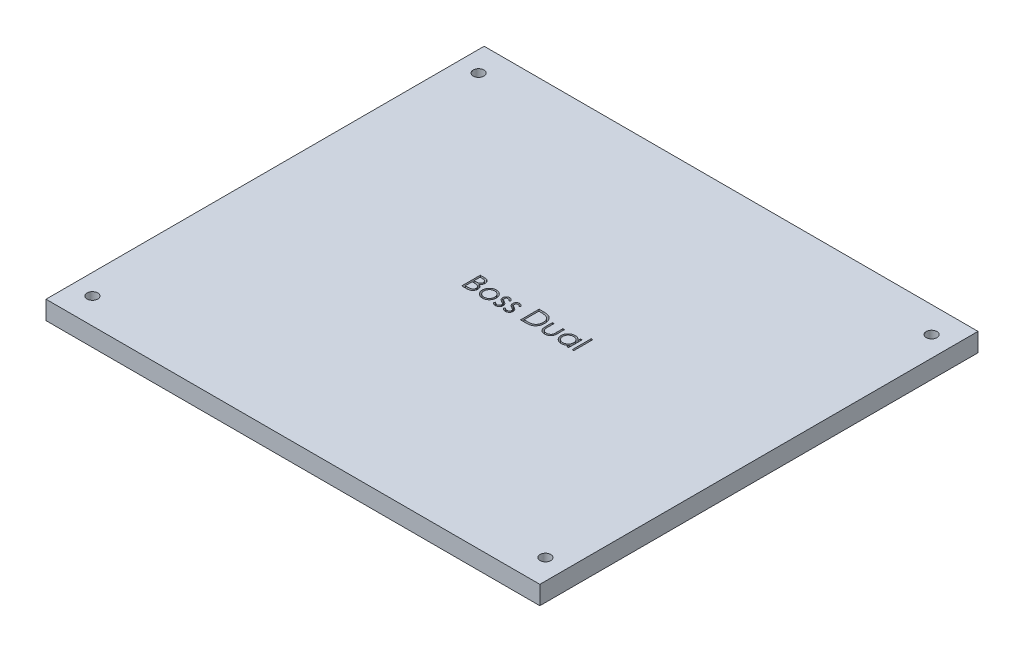
from build123d import *

# Parameters (mm, degrees)
SKETCH2_W           = 168.91
SKETCH2_H           = 149.86
BOSS_EXTRUDE1_DEPTH = 6.35
SKETCH3_R           = 1.8288
CUT_EXTRUDE1_DEPTH  = 114.081715697
SKETCH5_W           = 0.569871795
SKETCH5_H           = 6.512820513
CUT_EXTRUDE2_DEPTH  = 2.54


with BuildPart() as part:
    # Sketch2 → Boss-Extrude1 (new body)
    with BuildSketch(Plane(origin=(0, 0, 0), x_dir=(1, 0, 0), z_dir=(0, 1, 0))):
        Rectangle(SKETCH2_W, SKETCH2_H)
    extrude(amount=BOSS_EXTRUDE1_DEPTH)

    # Sketch3 → Cut-Extrude1 (cut, through all)
    with BuildSketch(Plane(origin=(0, 6.35, 0), x_dir=(1, 0, 0), z_dir=(0, 1, 0))):
        with Locations((-77.47, 66.04)):
            Circle(SKETCH3_R)
        with Locations((77.47, 66.04)):
            Circle(SKETCH3_R)
        with Locations((77.47, -66.04)):
            Circle(SKETCH3_R)
        with Locations((-77.47, -66.04)):
            Circle(SKETCH3_R)
    extrude(amount=-CUT_EXTRUDE1_DEPTH, mode=Mode.SUBTRACT)

    # Sketch5 → Cut-Extrude2 (cut)
    # profile 1 of 8: a face of its own
    with BuildSketch(Plane(origin=(0, 6.35, 0), x_dir=(1, 0, 0), z_dir=(0, 1, 0))):
        with BuildLine():
            Line((-17.296209186, 6.449507207), (-16.057246847, 6.449507207))
            add(Edge.make_bspline(
                [(-16.057246847, 6.449507207), (-15.996598036, 6.449188346), (-15.879045548, 6.448570313), (-15.70810456, 6.438985204), (-15.547996004, 6.425915688), (-15.398673445, 6.405178235), (-15.260205885, 6.38015601), (-15.132176029, 6.349854144), (-15.014991002, 6.313520145), (-14.875086466, 6.255741892), (-14.715573267, 6.169884144), (-14.542856183, 6.043013747), (-14.395165635, 5.887833421), (-14.267827602, 5.712786317), (-14.166588428, 5.520225703), (-14.093346989, 5.314741175), (-14.0469777, 5.098983157), (-14.04220897, 4.950859106), (-14.03979893, 4.875999595)],
                knots=[0, 0, 0, 0, 1.001505555, 1.941167018, 2.826882275, 3.653841531, 4.429895133, 5.150066043, 5.825578002, 6.45369114, 7.647487171, 8.808567382, 9.977351308, 11.170798116, 12.373658725, 13.556498008, 14.765093433, 16, 16, 16, 16], degree=3))
            add(Edge.make_bspline(
                [(-14.03979893, 4.875999595), (-14.041782341, 4.805872816), (-14.04567993, 4.66806708), (-14.082950364, 4.466510625), (-14.141299006, 4.274647699), (-14.222407101, 4.093178515), (-14.327820722, 3.926203245), (-14.452749386, 3.772374919), (-14.603474442, 3.638206573), (-14.716401463, 3.563198736), (-14.773763273, 3.525098153)],
                knots=[0, 0, 0, 0, 1.044552857, 2.05264487, 3.044412934, 4.028983338, 5.005914585, 5.980388656, 6.974128949, 8, 8, 8, 8], degree=3))
            add(Edge.make_bspline(
                [(-14.773763273, 3.525098153), (-14.701626497, 3.497403083), (-14.563610976, 3.444415555), (-14.373680639, 3.35073407), (-14.21004142, 3.248839956), (-14.071435169, 3.137566456), (-13.952893995, 3.017626185), (-13.849383659, 2.887260478), (-13.761061737, 2.744768731), (-13.685382576, 2.591636603), (-13.626329833, 2.429427725), (-13.582104977, 2.259663602), (-13.556764034, 2.082952981), (-13.553157885, 1.962692364), (-13.551337392, 1.901981166)],
                knots=[0, 0, 0, 0, 1.27268992, 2.434971085, 3.483601985, 4.442670788, 5.356604649, 6.2567628, 7.179492994, 8.113709626, 9.066344395, 10.018646069, 10.999752585, 12, 12, 12, 12], degree=3))
            add(Edge.make_bspline(
                [(-13.551337392, 1.901981166), (-13.553109669, 1.839992698), (-13.556596676, 1.71802865), (-13.582323196, 1.538858621), (-13.625882576, 1.367635503), (-13.685883084, 1.203251814), (-13.764191855, 1.04602557), (-13.85949259, 0.895778649), (-13.973124141, 0.754020649), (-14.100238204, 0.619176361), (-14.244042382, 0.497931661), (-14.399192394, 0.389953165), (-14.567642146, 0.301151024), (-14.74662505, 0.226554813), (-14.93814888, 0.169573182), (-15.141353611, 0.129708655), (-15.356063987, 0.102848088), (-15.503401678, 0.10063973), (-15.57896159, 0.099507207)],
                knots=[0, 0, 0, 0, 0.978564426, 1.925352924, 2.850884081, 3.763762016, 4.682927383, 5.618979971, 6.567305752, 7.547517671, 8.540179244, 9.531824382, 10.526200242, 11.540722885, 12.589160233, 13.674978461, 14.80764778, 16, 16, 16, 16], degree=3))
            Line((-15.57896159, 0.099507207), (-17.296209186, 0.099507207))
            Line((-17.296209186, 0.099507207), (-17.296209186, 6.449507207))
        make_face()
        with BuildLine():
            Line((-16.726337392, 5.798225156), (-16.726337392, 3.762968746))
            Line((-16.726337392, 3.762968746), (-16.343454779, 3.762968746))
            add(Edge.make_bspline(
                [(-16.343454779, 3.762968746), (-16.287486251, 3.76369432), (-16.179343647, 3.765096278), (-16.022734692, 3.769112231), (-15.877365016, 3.780357252), (-15.743485548, 3.791599042), (-15.621307114, 3.809877223), (-15.511100394, 3.83163436), (-15.411135796, 3.854644773), (-15.295856907, 3.893777985), (-15.165095986, 3.951613196), (-15.025698783, 4.041369242), (-14.902809102, 4.148274854), (-14.799037061, 4.271629885), (-14.714107679, 4.407458536), (-14.65511851, 4.553593591), (-14.615118438, 4.706392973), (-14.611505231, 4.811291803), (-14.609670725, 4.864551278)],
                knots=[0, 0, 0, 0, 1.156816544, 2.235205308, 3.236616184, 4.169592532, 5.011045266, 5.787822928, 6.49130361, 7.128639758, 8.301311294, 9.436451833, 10.541879658, 11.654887649, 12.756523258, 13.837046038, 14.901820046, 16, 16, 16, 16], degree=3))
            add(Edge.make_bspline(
                [(-14.609670725, 4.864551278), (-14.610625366, 4.899795178), (-14.612497999, 4.968929936), (-14.627834705, 5.069712335), (-14.65390159, 5.164497429), (-14.687382951, 5.254584172), (-14.734171, 5.337155672), (-14.789258998, 5.415066898), (-14.855817322, 5.485664599), (-14.931577018, 5.55164926), (-15.018678376, 5.610150046), (-15.117069434, 5.66138686), (-15.228081363, 5.702645126), (-15.349843257, 5.738778717), (-15.484229373, 5.764157478), (-15.62968892, 5.785300053), (-15.787413338, 5.796063742), (-15.896533739, 5.797488615), (-15.952939956, 5.798225156)],
                knots=[0, 0, 0, 0, 0.91205012, 1.789085906, 2.630437955, 3.453916878, 4.269457761, 5.079663411, 5.91843418, 6.774407191, 7.675494373, 8.627863946, 9.638891023, 10.736472738, 11.911756761, 13.175263542, 14.539845004, 16, 16, 16, 16], degree=3))
            Line((-15.952939956, 5.798225156), (-16.726337392, 5.798225156))
        make_face(mode=Mode.SUBTRACT)
        with BuildLine():
            Line((-16.726337392, 3.111686695), (-16.726337392, 0.750789259))
            Line((-16.726337392, 0.750789259), (-15.914778898, 0.750789259))
            add(Edge.make_bspline(
                [(-15.914778898, 0.750789259), (-15.856687418, 0.751485486), (-15.744723749, 0.752827373), (-15.58306866, 0.757208065), (-15.433239315, 0.767172622), (-15.295919411, 0.782858663), (-15.169626161, 0.79987385), (-15.055874615, 0.822754317), (-14.953742678, 0.848968859), (-14.835316434, 0.889489429), (-14.701960069, 0.95243874), (-14.558248944, 1.047351694), (-14.430475662, 1.160423981), (-14.321971835, 1.291290068), (-14.23304827, 1.433586904), (-14.168359087, 1.584436325), (-14.12846139, 1.741345782), (-14.123631454, 1.848328246), (-14.121209186, 1.901981166)],
                knots=[0, 0, 0, 0, 1.160039823, 2.235823828, 3.228722157, 4.157150951, 4.99529583, 5.772374946, 6.472645482, 7.099169577, 8.269452708, 9.405989375, 10.527446681, 11.663510218, 12.788923519, 13.866172445, 14.929861265, 16, 16, 16, 16], degree=3))
            add(Edge.make_bspline(
                [(-14.121209186, 1.901981166), (-14.121710119, 1.935533369), (-14.122703903, 2.002096576), (-14.137691019, 2.099915277), (-14.159487611, 2.194667933), (-14.187666069, 2.286611833), (-14.228704245, 2.374084673), (-14.276613263, 2.45881646), (-14.332786092, 2.540919201), (-14.420314793, 2.644718575), (-14.547626822, 2.76431087), (-14.7285234, 2.881400338), (-14.93421314, 2.975829931), (-15.083397306, 3.015924695), (-15.160461991, 3.036636614)],
                knots=[0, 0, 0, 0, 0.723448775, 1.435228256, 2.130040452, 2.821711965, 3.505591119, 4.210454504, 4.921174351, 5.648778258, 7.137944449, 8.670945889, 10.280296675, 12, 12, 12, 12], degree=3))
            add(Edge.make_bspline(
                [(-15.160461991, 3.036636614), (-15.191357636, 3.042905124), (-15.258345768, 3.056496545), (-15.367579521, 3.070843379), (-15.492286026, 3.08362513), (-15.632753246, 3.093079659), (-15.789158901, 3.102852388), (-15.961837025, 3.106652992), (-16.150082439, 3.111187364), (-16.280697171, 3.111515993), (-16.34854292, 3.111686695)],
                knots=[0, 0, 0, 0, 0.634451884, 1.375622551, 2.216452059, 3.157844607, 4.20941857, 5.370758133, 6.634282058, 8, 8, 8, 8], degree=3))
            Line((-16.34854292, 3.111686695), (-16.726337392, 3.111686695))
        make_face(mode=Mode.SUBTRACT)
    # profile 2 of 8: a face of its own
    with BuildSketch(Plane(origin=(0, 6.35, 0), x_dir=(1, 0, 0), z_dir=(0, 1, 0))):
        with BuildLine():
            add(Edge.make_bspline(
                [(-10.17026768, 4.821302079), (-10.083197799, 4.819448077), (-9.912475042, 4.815812831), (-9.662452163, 4.776959965), (-9.423791702, 4.717546889), (-9.195579611, 4.635411341), (-8.980738618, 4.525316945), (-8.776139361, 4.393945802), (-8.582342787, 4.238311668), (-8.46618672, 4.117919173), (-8.407226815, 4.05680889)],
                knots=[0, 0, 0, 0, 1.054011418, 2.066658804, 3.057071809, 4.030435133, 4.997543892, 5.974964718, 6.972108034, 8, 8, 8, 8], degree=3))
            add(Edge.make_bspline(
                [(-8.407226815, 4.05680889), (-8.356459555, 3.998363516), (-8.255907522, 3.882603846), (-8.126974004, 3.694905806), (-8.015900602, 3.500523052), (-7.926886373, 3.296874331), (-7.856700687, 3.085737427), (-7.806870067, 2.866386636), (-7.777230199, 2.639306377), (-7.773233388, 2.485085128), (-7.771209186, 2.406979163)],
                knots=[0, 0, 0, 0, 1.025258237, 2.030674902, 3.01204498, 3.988269485, 4.97094183, 5.956517959, 6.965070386, 8, 8, 8, 8], degree=3))
            add(Edge.make_bspline(
                [(-7.771209186, 2.406979163), (-7.772989613, 2.328420486), (-7.776507818, 2.173184879), (-7.809788379, 1.944549744), (-7.861551921, 1.722853423), (-7.935632542, 1.509024078), (-8.030625111, 1.302408091), (-8.146541073, 1.103907909), (-8.284193864, 0.913131896), (-8.440229687, 0.731699989), (-8.612680948, 0.564484143), (-8.799763102, 0.418745711), (-8.997799707, 0.293883802), (-9.209424076, 0.193306305), (-9.432703659, 0.11400442), (-9.668120054, 0.058305819), (-9.915307539, 0.024629621), (-10.084085498, 0.020305138), (-10.17026768, 0.018096951)],
                knots=[0, 0, 0, 0, 0.998656419, 1.973391657, 2.932242238, 3.890759089, 4.846373663, 5.82037756, 6.809684879, 7.83454468, 8.860553229, 9.859544525, 10.845671541, 11.83227036, 12.833544569, 13.85385346, 14.904124723, 16, 16, 16, 16], degree=3))
            add(Edge.make_bspline(
                [(-10.17026768, 0.018096951), (-10.2568721, 0.02031255), (-10.426491231, 0.024651912), (-10.674551227, 0.058174982), (-10.910389535, 0.113978751), (-11.133961421, 0.193566916), (-11.346495644, 0.293887017), (-11.545679717, 0.418368225), (-11.732913849, 0.564527364), (-11.905401592, 0.731688278), (-12.061427633, 0.913134913), (-12.199082948, 1.103907126), (-12.314998254, 1.302408295), (-12.409990996, 1.509024024), (-12.484071571, 1.722853437), (-12.535835125, 1.94454974), (-12.569115682, 2.17318488), (-12.572633888, 2.328420487), (-12.574414315, 2.406979163)],
                knots=[0, 0, 0, 0, 1.099876186, 2.154163076, 3.173186993, 4.173200201, 5.163417411, 6.152872554, 7.150605724, 8.17532212, 9.198891216, 10.186952605, 11.159729845, 12.11414092, 13.071450619, 14.029093627, 15.002601286, 16, 16, 16, 16], degree=3))
            add(Edge.make_bspline(
                [(-12.574414315, 2.406979163), (-12.572376309, 2.48466061), (-12.568341407, 2.638456526), (-12.538731341, 2.865109907), (-12.489095103, 3.084089456), (-12.418825283, 3.294411391), (-12.32899058, 3.497167682), (-12.219477957, 3.692030733), (-12.089229238, 3.878880028), (-11.989077126, 3.994490087), (-11.938396686, 4.052992784)],
                knots=[0, 0, 0, 0, 1.031353054, 2.041901799, 3.029428768, 4.008703097, 4.981709435, 5.96992636, 6.972712378, 8, 8, 8, 8], degree=3))
            add(Edge.make_bspline(
                [(-11.938396686, 4.052992784), (-11.879525671, 4.114633031), (-11.763745461, 4.235859423), (-11.568984198, 4.39103986), (-11.364888265, 4.525144736), (-11.147673042, 4.633051584), (-10.919648429, 4.718030038), (-10.679764946, 4.777113187), (-10.428893653, 4.815672845), (-10.257335484, 4.819406968), (-10.17026768, 4.821302079)],
                knots=[0, 0, 0, 0, 1.027980169, 2.021703884, 2.998553061, 3.971491411, 4.943284454, 5.930300938, 6.949603206, 8, 8, 8, 8], degree=3))
        make_face()
        with BuildLine():
            add(Edge.make_bspline(
                [(-10.172811751, 4.251430284), (-10.234384274, 4.249680239), (-10.355939836, 4.246225327), (-10.53486394, 4.219947385), (-10.707112505, 4.178314057), (-10.873012322, 4.119160983), (-11.032003935, 4.042781552), (-11.184239565, 3.948967813), (-11.330166991, 3.838962306), (-11.466931592, 3.712937173), (-11.592448073, 3.575270998), (-11.702172402, 3.428588975), (-11.795472238, 3.275270318), (-11.873196526, 3.115155592), (-11.931085281, 2.946622213), (-11.973127765, 2.771578782), (-11.999380916, 2.589668669), (-12.002803345, 2.466005107), (-12.00454252, 2.403163057)],
                knots=[0, 0, 0, 0, 1.021534396, 2.016698045, 2.994645724, 3.958388632, 4.93408049, 5.916473867, 6.921342795, 7.962252576, 8.998418191, 10.008913653, 10.997312074, 11.973003931, 12.956656626, 13.948281152, 14.957379055, 16, 16, 16, 16], degree=3))
            add(Edge.make_bspline(
                [(-12.00454252, 2.403163057), (-12.001627283, 2.321970093), (-11.995841082, 2.160817243), (-11.948787153, 1.923488492), (-11.870072045, 1.695647132), (-11.763777981, 1.478628831), (-11.630598127, 1.277837698), (-11.473685877, 1.098819434), (-11.294725278, 0.944268033), (-11.095849628, 0.816032785), (-10.881121079, 0.714142942), (-10.653870325, 0.641936229), (-10.416850781, 0.594997587), (-10.254870025, 0.590332198), (-10.172811751, 0.587968746)],
                knots=[0, 0, 0, 0, 1.016792936, 2.018143844, 3.017858371, 4.030088057, 5.03801393, 6.028138512, 7.003788237, 7.991172063, 8.984598303, 9.972568034, 10.972917682, 12, 12, 12, 12], degree=3))
            add(Edge.make_bspline(
                [(-10.172811751, 0.587968746), (-10.090758196, 0.590345969), (-9.928786757, 0.59503854), (-9.692096536, 0.641699828), (-9.465466902, 0.714459326), (-9.250961384, 0.815918193), (-9.052176261, 0.944755002), (-8.871928569, 1.097946715), (-8.716356089, 1.278311845), (-8.583307977, 1.478894791), (-8.475273173, 1.695310687), (-8.396926507, 1.923530543), (-8.349759458, 2.160806534), (-8.343988526, 2.321966505), (-8.341080981, 2.403163057)],
                knots=[0, 0, 0, 0, 1.02726834, 2.027799167, 3.010890988, 4.004497153, 4.992059811, 5.971914811, 6.958719428, 7.966827853, 8.981595046, 9.981490638, 10.983022906, 12, 12, 12, 12], degree=3))
            add(Edge.make_bspline(
                [(-8.341080981, 2.403163057), (-8.342819557, 2.466005483), (-8.346240808, 2.589669784), (-8.372502529, 2.771574521), (-8.414513294, 2.946637846), (-8.472518943, 3.115097909), (-8.549905511, 3.275684882), (-8.64500455, 3.428138815), (-8.754280839, 3.57577912), (-8.881311901, 3.712492154), (-9.017933743, 3.839011435), (-9.163920313, 3.94901047), (-9.315930202, 4.04236925), (-9.474459917, 4.119814286), (-9.640381004, 4.17777589), (-9.812388224, 4.220187778), (-9.990548922, 4.246114278), (-10.1116689, 4.249646949), (-10.172811751, 4.251430284)],
                knots=[0, 0, 0, 0, 1.042956736, 2.052379634, 3.044323526, 4.02829302, 5.004299113, 5.996692471, 7.007513377, 8.048758398, 9.090003419, 10.095195979, 11.07790575, 12.047570684, 13.018257071, 13.989683339, 14.985167495, 16, 16, 16, 16], degree=3))
        make_face(mode=Mode.SUBTRACT)
    # profile 3 of 8: a face of its own
    with BuildSketch(Plane(origin=(0, 6.35, 0), x_dir=(1, 0, 0), z_dir=(0, 1, 0))):
        with BuildLine():
            Line((-4.433388674, 4.161115781), (-4.820087392, 3.762968746))
            add(Edge.make_bspline(
                [(-4.820087392, 3.762968746), (-4.853453019, 3.801636883), (-4.917778022, 3.876184499), (-5.019797995, 3.975856034), (-5.121440818, 4.059561623), (-5.221315094, 4.13023215), (-5.32193224, 4.183661316), (-5.422111505, 4.222659137), (-5.521956617, 4.246792413), (-5.588696995, 4.249902894), (-5.621469603, 4.251430284)],
                knots=[0, 0, 0, 0, 1.26578478, 2.440284043, 3.530471711, 4.527705817, 5.468200915, 6.346673037, 7.188140097, 8, 8, 8, 8], degree=3))
            add(Edge.make_bspline(
                [(-5.621469603, 4.251430284), (-5.661636782, 4.249480158), (-5.740680105, 4.245642584), (-5.853938375, 4.207336789), (-5.959077366, 4.148538078), (-6.050076459, 4.065137934), (-6.12716125, 3.969408474), (-6.183428928, 3.862372285), (-6.217838641, 3.747259406), (-6.222201512, 3.667376664), (-6.224414315, 3.626860973)],
                knots=[0, 0, 0, 0, 0.99966794, 1.967205029, 2.953328237, 3.988086729, 5.028030931, 6.008226631, 6.989793394, 8, 8, 8, 8], degree=3))
            add(Edge.make_bspline(
                [(-6.224414315, 3.626860973), (-6.222398984, 3.59019055), (-6.218374003, 3.516953078), (-6.1870836, 3.408915931), (-6.137252297, 3.303583876), (-6.090679231, 3.239062603), (-6.066681943, 3.205817304)],
                knots=[0, 0, 0, 0, 0.960159726, 1.917612774, 2.927026955, 4, 4, 4, 4], degree=3))
            add(Edge.make_bspline(
                [(-6.066681943, 3.205817304), (-6.05223389, 3.188065272), (-6.02148303, 3.15028231), (-5.963773296, 3.097842462), (-5.898418183, 3.039890092), (-5.819823439, 2.981947545), (-5.731375146, 2.920929987), (-5.631155302, 2.859240402), (-5.522344414, 2.792176374), (-5.444443872, 2.74964147), (-5.403951574, 2.727532047)],
                knots=[0, 0, 0, 0, 0.66740084, 1.420478572, 2.27185888, 3.217733974, 4.268547843, 5.408967954, 6.65319498, 8, 8, 8, 8], degree=3))
            add(Edge.make_bspline(
                [(-5.403951574, 2.727532047), (-5.35457837, 2.699873438), (-5.259205597, 2.646446112), (-5.123691577, 2.56351565), (-5.000706517, 2.481090066), (-4.889208377, 2.400050869), (-4.791342524, 2.318130666), (-4.704139692, 2.23846945), (-4.629774944, 2.158660276), (-4.588129963, 2.102901627), (-4.568224411, 2.076249996)],
                knots=[0, 0, 0, 0, 1.27191281, 2.456916733, 3.569705269, 4.599008579, 5.553216877, 6.436649441, 7.252746552, 8, 8, 8, 8], degree=3))
            add(Edge.make_bspline(
                [(-4.568224411, 2.076249996), (-4.535185311, 2.022427236), (-4.469431371, 1.915309955), (-4.400382802, 1.738927951), (-4.36035916, 1.551856039), (-4.354803418, 1.42389044), (-4.351978417, 1.358822111)],
                knots=[0, 0, 0, 0, 0.995354457, 1.980940102, 2.973342416, 4, 4, 4, 4], degree=3))
            add(Edge.make_bspline(
                [(-4.351978417, 1.358822111), (-4.353283857, 1.31297666), (-4.355856369, 1.222633191), (-4.373741719, 1.089582857), (-4.404502891, 0.962338731), (-4.446401558, 0.839520143), (-4.502978921, 0.723480353), (-4.569287067, 0.611291729), (-4.648888693, 0.505381112), (-4.73976876, 0.40588757), (-4.839274156, 0.315017714), (-4.945421007, 0.235145683), (-5.058340028, 0.168789386), (-5.177224368, 0.113879402), (-5.30234414, 0.070212706), (-5.433718908, 0.039982114), (-5.570931077, 0.021888676), (-5.664239443, 0.01937684), (-5.711784106, 0.018096951)],
                knots=[0, 0, 0, 0, 1.032770009, 2.035186124, 3.017557409, 3.978232242, 4.952395191, 5.920591857, 6.910227898, 7.931268572, 8.952309245, 9.941945286, 10.918353717, 11.897095711, 12.887975737, 13.898235213, 14.929059601, 16, 16, 16, 16], degree=3))
            add(Edge.make_bspline(
                [(-5.711784106, 0.018096951), (-5.775950268, 0.019897993), (-5.903391006, 0.023475052), (-6.09187664, 0.057050334), (-6.276064302, 0.109293406), (-6.454560154, 0.181349458), (-6.623372389, 0.27233718), (-6.777824209, 0.381307523), (-6.918452148, 0.504660804), (-6.998495302, 0.599208513), (-7.038516879, 0.646482368)],
                knots=[0, 0, 0, 0, 1.013940152, 2.01379169, 3.017749504, 4.037548394, 5.051665909, 6.043208538, 7.021604269, 8, 8, 8, 8], degree=3))
            Line((-7.038516879, 0.646482368), (-6.660722408, 1.076430284))
            add(Edge.make_bspline(
                [(-6.660722408, 1.076430284), (-6.624849601, 1.03768664), (-6.555304742, 0.962576228), (-6.44408682, 0.862564924), (-6.330912764, 0.778742618), (-6.21691269, 0.708632422), (-6.10039909, 0.654611334), (-5.982024904, 0.616659028), (-5.862030906, 0.592267422), (-5.78143646, 0.589403967), (-5.741040917, 0.587968746)],
                knots=[0, 0, 0, 0, 1.179806542, 2.287233372, 3.337373186, 4.324005949, 5.273901747, 6.200048787, 7.097828587, 8, 8, 8, 8], degree=3))
            add(Edge.make_bspline(
                [(-5.741040917, 0.587968746), (-5.686035537, 0.590455814), (-5.578564252, 0.595315127), (-5.424633433, 0.63943328), (-5.282504782, 0.708611907), (-5.159090998, 0.806737002), (-5.054039934, 0.920956398), (-4.977970246, 1.049614872), (-4.930297757, 1.188936515), (-4.924698873, 1.285515121), (-4.921850212, 1.334653441)],
                knots=[0, 0, 0, 0, 1.072336372, 2.095165389, 3.102688358, 4.141489647, 5.156069229, 6.117746104, 7.042326257, 8, 8, 8, 8], degree=3))
            add(Edge.make_bspline(
                [(-4.921850212, 1.334653441), (-4.92382106, 1.375129464), (-4.927712237, 1.455043952), (-4.958270744, 1.570705285), (-5.006554062, 1.680413837), (-5.054096781, 1.744620768), (-5.078310549, 1.777321711)],
                knots=[0, 0, 0, 0, 1.013901739, 2.00181326, 2.98231254, 4, 4, 4, 4], degree=3))
            add(Edge.make_bspline(
                [(-5.078310549, 1.777321711), (-5.092865464, 1.793714439), (-5.124571327, 1.829423722), (-5.182728693, 1.880994937), (-5.252364358, 1.936581202), (-5.33426151, 1.995239942), (-5.428585249, 2.056197412), (-5.535717868, 2.119133808), (-5.654191728, 2.187038396), (-5.737958445, 2.232068342), (-5.781746045, 2.255606967)],
                knots=[0, 0, 0, 0, 0.615000592, 1.339693406, 2.178160186, 3.116406724, 4.166410947, 5.330106347, 6.604359322, 8, 8, 8, 8], degree=3))
            add(Edge.make_bspline(
                [(-5.781746045, 2.255606967), (-5.829002092, 2.281985106), (-5.920646649, 2.333140735), (-6.050453876, 2.412817052), (-6.167561219, 2.493856251), (-6.274786547, 2.571712402), (-6.369421515, 2.6504904), (-6.451093307, 2.730277699), (-6.523017427, 2.807856531), (-6.562836302, 2.862824484), (-6.581856222, 2.889080525)],
                knots=[0, 0, 0, 0, 1.262093308, 2.447601706, 3.550203992, 4.582594899, 5.537233252, 6.418365656, 7.244515135, 8, 8, 8, 8], degree=3))
            add(Edge.make_bspline(
                [(-6.581856222, 2.889080525), (-6.61475031, 2.941958998), (-6.680549981, 3.047734423), (-6.744440399, 3.22428343), (-6.788357051, 3.410148034), (-6.792280245, 3.538394184), (-6.79428611, 3.603964339)],
                knots=[0, 0, 0, 0, 0.985009483, 1.970363186, 2.962279964, 4, 4, 4, 4], degree=3))
            add(Edge.make_bspline(
                [(-6.79428611, 3.603964339), (-6.793316927, 3.646827561), (-6.791420098, 3.730716959), (-6.776281605, 3.85397739), (-6.7487195, 3.971086184), (-6.714148426, 4.083802064), (-6.66610069, 4.189941577), (-6.608685976, 4.290920132), (-6.541217362, 4.386598154), (-6.463487392, 4.475503837), (-6.378022478, 4.556256472), (-6.285684825, 4.626648268), (-6.18855113, 4.686712655), (-6.086210141, 4.737086589), (-5.977678711, 4.775189097), (-5.863715467, 4.801418925), (-5.744551086, 4.818936221), (-5.663087615, 4.820502103), (-5.621469603, 4.821302079)],
                knots=[0, 0, 0, 0, 1.087655834, 2.128696564, 3.144119009, 4.137814668, 5.115653402, 6.093965665, 7.082169637, 8.081268856, 9.086088321, 10.061021666, 11.022561449, 11.980240094, 12.950172527, 13.934149372, 14.944599409, 16, 16, 16, 16], degree=3))
            add(Edge.make_bspline(
                [(-5.621469603, 4.821302079), (-5.572135431, 4.81929849), (-5.472541628, 4.815253725), (-5.323126807, 4.783130544), (-5.173932029, 4.730274769), (-5.024573951, 4.657274746), (-4.876146712, 4.562810557), (-4.727344701, 4.448638828), (-4.57638156, 4.315510689), (-4.482117963, 4.213730665), (-4.433388674, 4.161115781)],
                knots=[0, 0, 0, 0, 0.845714091, 1.707292901, 2.609013841, 3.555613372, 4.552488639, 5.621697636, 6.770543573, 8, 8, 8, 8], degree=3))
        make_face()
    # profile 4 of 8: a face of its own
    with BuildSketch(Plane(origin=(0, 6.35, 0), x_dir=(1, 0, 0), z_dir=(0, 1, 0))):
        with BuildLine():
            Line((-1.014157904, 4.161115781), (-1.400856622, 3.762968746))
            add(Edge.make_bspline(
                [(-1.400856622, 3.762968746), (-1.43422225, 3.801636883), (-1.498547253, 3.876184499), (-1.600567225, 3.975856034), (-1.702210049, 4.059561623), (-1.802084325, 4.13023215), (-1.90270147, 4.183661316), (-2.002880736, 4.222659137), (-2.102725847, 4.246792413), (-2.169466226, 4.249902894), (-2.202238834, 4.251430284)],
                knots=[0, 0, 0, 0, 1.26578478, 2.440284043, 3.530471711, 4.527705817, 5.468200915, 6.346673037, 7.188140097, 8, 8, 8, 8], degree=3))
            add(Edge.make_bspline(
                [(-2.202238834, 4.251430284), (-2.242406013, 4.249480158), (-2.321449336, 4.245642584), (-2.434707606, 4.207336789), (-2.539846597, 4.148538078), (-2.63084569, 4.065137934), (-2.70793048, 3.969408474), (-2.764198159, 3.862372285), (-2.798607872, 3.747259406), (-2.802970743, 3.667376664), (-2.805183545, 3.626860973)],
                knots=[0, 0, 0, 0, 0.99966794, 1.967205029, 2.953328237, 3.988086729, 5.028030931, 6.008226631, 6.989793394, 8, 8, 8, 8], degree=3))
            add(Edge.make_bspline(
                [(-2.805183545, 3.626860973), (-2.803168215, 3.59019055), (-2.799143234, 3.516953078), (-2.76785283, 3.408915931), (-2.718021528, 3.303583876), (-2.671448461, 3.239062603), (-2.647451174, 3.205817304)],
                knots=[0, 0, 0, 0, 0.960159726, 1.917612774, 2.927026955, 4, 4, 4, 4], degree=3))
            add(Edge.make_bspline(
                [(-2.647451174, 3.205817304), (-2.633003121, 3.188065272), (-2.602252261, 3.15028231), (-2.544542527, 3.097842462), (-2.479187414, 3.039890092), (-2.40059267, 2.981947545), (-2.312144377, 2.920929987), (-2.211924532, 2.859240402), (-2.103113645, 2.792176374), (-2.025213103, 2.74964147), (-1.984720805, 2.727532047)],
                knots=[0, 0, 0, 0, 0.66740084, 1.420478572, 2.27185888, 3.217733974, 4.268547843, 5.408967954, 6.65319498, 8, 8, 8, 8], degree=3))
            add(Edge.make_bspline(
                [(-1.984720805, 2.727532047), (-1.935347601, 2.699873438), (-1.839974828, 2.646446112), (-1.704460808, 2.56351565), (-1.581475747, 2.481090066), (-1.469977608, 2.400050869), (-1.372111754, 2.318130666), (-1.284908923, 2.23846945), (-1.210544175, 2.158660276), (-1.168899194, 2.102901627), (-1.148993642, 2.076249996)],
                knots=[0, 0, 0, 0, 1.27191281, 2.456916733, 3.569705269, 4.599008579, 5.553216877, 6.436649441, 7.252746552, 8, 8, 8, 8], degree=3))
            add(Edge.make_bspline(
                [(-1.148993642, 2.076249996), (-1.115954542, 2.022427236), (-1.050200602, 1.915309955), (-0.981152032, 1.738927951), (-0.941128391, 1.551856039), (-0.935572648, 1.42389044), (-0.932747648, 1.358822111)],
                knots=[0, 0, 0, 0, 0.995354457, 1.980940102, 2.973342416, 4, 4, 4, 4], degree=3))
            add(Edge.make_bspline(
                [(-0.932747648, 1.358822111), (-0.934053088, 1.31297666), (-0.9366256, 1.222633191), (-0.95451095, 1.089582857), (-0.985272121, 0.962338731), (-1.027170789, 0.839520143), (-1.083748151, 0.723480353), (-1.150056298, 0.611291729), (-1.229657923, 0.505381112), (-1.32053799, 0.40588757), (-1.420043387, 0.315017714), (-1.526190238, 0.235145683), (-1.639109259, 0.168789386), (-1.757993599, 0.113879402), (-1.883113371, 0.070212706), (-2.014488139, 0.039982114), (-2.151700308, 0.021888676), (-2.245008674, 0.01937684), (-2.292553337, 0.018096951)],
                knots=[0, 0, 0, 0, 1.032770009, 2.035186124, 3.017557409, 3.978232242, 4.952395191, 5.920591857, 6.910227898, 7.931268572, 8.952309245, 9.941945286, 10.918353717, 11.897095711, 12.887975737, 13.898235213, 14.929059601, 16, 16, 16, 16], degree=3))
            add(Edge.make_bspline(
                [(-2.292553337, 0.018096951), (-2.356719498, 0.019897993), (-2.484160237, 0.023475052), (-2.67264587, 0.057050334), (-2.856833533, 0.109293406), (-3.035329384, 0.181349458), (-3.20414162, 0.27233718), (-3.35859344, 0.381307523), (-3.499221379, 0.504660804), (-3.579264533, 0.599208513), (-3.61928611, 0.646482368)],
                knots=[0, 0, 0, 0, 1.013940152, 2.01379169, 3.017749504, 4.037548394, 5.051665909, 6.043208538, 7.021604269, 8, 8, 8, 8], degree=3))
            Line((-3.61928611, 0.646482368), (-3.241491638, 1.076430284))
            add(Edge.make_bspline(
                [(-3.241491638, 1.076430284), (-3.205618832, 1.03768664), (-3.136073973, 0.962576228), (-3.024856051, 0.862564924), (-2.911681995, 0.778742618), (-2.79768192, 0.708632422), (-2.681168321, 0.654611334), (-2.562794135, 0.616659028), (-2.442800137, 0.592267422), (-2.36220569, 0.589403967), (-2.321810148, 0.587968746)],
                knots=[0, 0, 0, 0, 1.179806542, 2.287233372, 3.337373186, 4.324005949, 5.273901747, 6.200048787, 7.097828587, 8, 8, 8, 8], degree=3))
            add(Edge.make_bspline(
                [(-2.321810148, 0.587968746), (-2.266804768, 0.590455814), (-2.159333483, 0.595315127), (-2.005402663, 0.63943328), (-1.863274013, 0.708611907), (-1.739860229, 0.806737002), (-1.634809165, 0.920956398), (-1.558739477, 1.049614872), (-1.511066987, 1.188936515), (-1.505468104, 1.285515121), (-1.502619443, 1.334653441)],
                knots=[0, 0, 0, 0, 1.072336372, 2.095165389, 3.102688358, 4.141489647, 5.156069229, 6.117746104, 7.042326257, 8, 8, 8, 8], degree=3))
            add(Edge.make_bspline(
                [(-1.502619443, 1.334653441), (-1.504590291, 1.375129464), (-1.508481467, 1.455043952), (-1.539039975, 1.570705285), (-1.587323293, 1.680413837), (-1.634866012, 1.744620768), (-1.659079779, 1.777321711)],
                knots=[0, 0, 0, 0, 1.013901739, 2.00181326, 2.98231254, 4, 4, 4, 4], degree=3))
            add(Edge.make_bspline(
                [(-1.659079779, 1.777321711), (-1.673634695, 1.793714439), (-1.705340558, 1.829423722), (-1.763497924, 1.880994937), (-1.833133589, 1.936581202), (-1.915030741, 1.995239942), (-2.009354479, 2.056197412), (-2.116487099, 2.119133808), (-2.234960959, 2.187038396), (-2.318727675, 2.232068342), (-2.362515276, 2.255606967)],
                knots=[0, 0, 0, 0, 0.615000592, 1.339693406, 2.178160186, 3.116406724, 4.166410947, 5.330106347, 6.604359322, 8, 8, 8, 8], degree=3))
            add(Edge.make_bspline(
                [(-2.362515276, 2.255606967), (-2.409771323, 2.281985106), (-2.501415879, 2.333140735), (-2.631223107, 2.412817052), (-2.74833045, 2.493856251), (-2.855555778, 2.571712402), (-2.950190745, 2.6504904), (-3.031862537, 2.730277699), (-3.103786657, 2.807856531), (-3.143605533, 2.862824484), (-3.162625453, 2.889080525)],
                knots=[0, 0, 0, 0, 1.262093308, 2.447601706, 3.550203992, 4.582594899, 5.537233252, 6.418365656, 7.244515135, 8, 8, 8, 8], degree=3))
            add(Edge.make_bspline(
                [(-3.162625453, 2.889080525), (-3.19551954, 2.941958998), (-3.261319211, 3.047734423), (-3.32520963, 3.22428343), (-3.369126282, 3.410148034), (-3.373049476, 3.538394184), (-3.37505534, 3.603964339)],
                knots=[0, 0, 0, 0, 0.985009483, 1.970363186, 2.962279964, 4, 4, 4, 4], degree=3))
            add(Edge.make_bspline(
                [(-3.37505534, 3.603964339), (-3.374086157, 3.646827561), (-3.372189329, 3.730716959), (-3.357050835, 3.85397739), (-3.329488731, 3.971086184), (-3.294917657, 4.083802064), (-3.24686992, 4.189941577), (-3.189455207, 4.290920132), (-3.121986593, 4.386598154), (-3.044256622, 4.475503837), (-2.958791709, 4.556256472), (-2.866454055, 4.626648268), (-2.769320361, 4.686712655), (-2.666979371, 4.737086589), (-2.558447942, 4.775189097), (-2.444484698, 4.801418925), (-2.325320317, 4.818936221), (-2.243856846, 4.820502103), (-2.202238834, 4.821302079)],
                knots=[0, 0, 0, 0, 1.087655834, 2.128696564, 3.144119009, 4.137814668, 5.115653402, 6.093965665, 7.082169637, 8.081268856, 9.086088321, 10.061021666, 11.022561449, 11.980240094, 12.950172527, 13.934149372, 14.944599409, 16, 16, 16, 16], degree=3))
            add(Edge.make_bspline(
                [(-2.202238834, 4.821302079), (-2.152904662, 4.81929849), (-2.053310859, 4.815253725), (-1.903896038, 4.783130544), (-1.75470126, 4.730274769), (-1.605343182, 4.657274746), (-1.456915943, 4.562810557), (-1.308113931, 4.448638828), (-1.157150791, 4.315510689), (-1.062887194, 4.213730665), (-1.014157904, 4.161115781)],
                knots=[0, 0, 0, 0, 0.845714091, 1.707292901, 2.609013841, 3.555613372, 4.552488639, 5.621697636, 6.770543573, 8, 8, 8, 8], degree=3))
        make_face()
    # profile 5 of 8: a face of its own
    with BuildSketch(Plane(origin=(0, 6.35, 0), x_dir=(1, 0, 0), z_dir=(0, 1, 0))):
        with BuildLine():
            Line((2.812124147, 0.099507207), (2.812124147, 6.449507207))
            Line((2.812124147, 6.449507207), (4.094335685, 6.449507207))
            add(Edge.make_bspline(
                [(4.094335685, 6.449507207), (4.205857992, 6.448704259), (4.42131851, 6.447152967), (4.732672521, 6.437317014), (5.020751633, 6.419917169), (5.284608392, 6.394572457), (5.524967162, 6.363451954), (5.741154923, 6.324444077), (5.934289525, 6.278382682), (6.053069796, 6.239111651), (6.109239531, 6.220540861)],
                knots=[0, 0, 0, 0, 1.314313732, 2.53924729, 3.670748893, 4.714932338, 5.66265055, 6.526160246, 7.303039223, 8, 8, 8, 8], degree=3))
            add(Edge.make_bspline(
                [(6.109239531, 6.220540861), (6.182708558, 6.192545152), (6.327980579, 6.137188585), (6.534822073, 6.032765009), (6.729540945, 5.91444981), (6.913181394, 5.782087031), (7.081548608, 5.631928856), (7.241220077, 5.470353858), (7.385663933, 5.29148644), (7.517940413, 5.099036105), (7.637203681, 4.895269953), (7.740870439, 4.680576256), (7.826965541, 4.456045321), (7.898436109, 4.222301553), (7.954763254, 3.978830982), (7.99319333, 3.72535011), (8.018540697, 3.462860724), (8.021088048, 3.284744197), (8.022380557, 3.194368986)],
                knots=[0, 0, 0, 0, 0.984719456, 1.947108742, 2.898477687, 3.838006223, 4.779231079, 5.722358779, 6.681677486, 7.655904652, 8.64651281, 9.637519902, 10.640069247, 11.656948941, 12.698408672, 13.768548281, 14.867775369, 16, 16, 16, 16], degree=3))
            add(Edge.make_bspline(
                [(8.022380557, 3.194368986), (8.02123943, 3.115880739), (8.018990721, 2.961211451), (7.998798962, 2.733262969), (7.969450496, 2.512076918), (7.924013165, 2.298706576), (7.86885432, 2.091282524), (7.798162217, 1.892015452), (7.717180674, 1.699077398), (7.622747322, 1.51507712), (7.519076524, 1.34075443), (7.407821361, 1.176424544), (7.2891005, 1.024432356), (7.161781851, 0.884317588), (7.027510709, 0.756291467), (6.885407995, 0.639284525), (6.735107031, 0.535586204), (6.577281006, 0.441121594), (6.407325743, 0.358716091), (6.2220221, 0.288993074), (6.02057982, 0.231214214), (5.803493355, 0.183007018), (5.570387617, 0.144766769), (5.321034064, 0.119137457), (5.05581581, 0.101805707), (4.873699143, 0.100288251), (4.779962689, 0.099507207)],
                knots=[0, 0, 0, 0, 1.105936401, 2.179363191, 3.223086493, 4.248585256, 5.251745608, 6.245858792, 7.225916811, 8.198733463, 9.158002045, 10.082870192, 10.993790845, 11.873723703, 12.748670949, 13.606408763, 14.465103618, 15.319838547, 16.196477973, 17.123216899, 18.106603292, 19.147568657, 20.255746949, 21.433717677, 22.679120308, 24, 24, 24, 24], degree=3))
            Line((4.779962689, 0.099507207), (2.812124147, 0.099507207))
        make_face()
        with BuildLine():
            Line((3.381995942, 0.750789259), (4.110872144, 0.750789259))
            add(Edge.make_bspline(
                [(4.110872144, 0.750789259), (4.215607902, 0.751239376), (4.417053122, 0.752105118), (4.706718346, 0.7597019), (4.971385251, 0.77211513), (5.211091418, 0.789487057), (5.425701505, 0.812471544), (5.615664022, 0.838098154), (5.780356277, 0.870024957), (5.880013969, 0.898964555), (5.926066455, 0.912337736)],
                knots=[0, 0, 0, 0, 1.375205317, 2.645023457, 3.804390687, 4.853969522, 5.800190428, 6.637939096, 7.370582563, 8, 8, 8, 8], degree=3))
            add(Edge.make_bspline(
                [(5.926066455, 0.912337736), (5.984029911, 0.932751278), (6.098572369, 0.973090783), (6.263456624, 1.046673969), (6.417230047, 1.13383601), (6.562572521, 1.230722992), (6.69742231, 1.340752167), (6.823377493, 1.461530961), (6.940184475, 1.593674053), (7.046636434, 1.737017432), (7.1419015, 1.890668919), (7.224399302, 2.053117945), (7.296701366, 2.222584587), (7.35344967, 2.401671203), (7.397927944, 2.588776781), (7.429432449, 2.783914482), (7.449053449, 2.987047865), (7.451342076, 3.125209576), (7.452508762, 3.195641022)],
                knots=[0, 0, 0, 0, 0.998632004, 1.973411704, 2.929992603, 3.868527914, 4.809262121, 5.754881198, 6.702106254, 7.672490631, 8.653608572, 9.636854334, 10.631411391, 11.644891563, 12.686317036, 13.754757253, 14.855430412, 16, 16, 16, 16], degree=3))
            add(Edge.make_bspline(
                [(7.452508762, 3.195641022), (7.451577512, 3.26990605), (7.449748064, 3.415800356), (7.426753243, 3.629869189), (7.39314985, 3.835755512), (7.344556591, 4.033473095), (7.282633425, 4.223407677), (7.205354575, 4.404508788), (7.117059423, 4.57868905), (7.012006226, 4.741928257), (6.896952221, 4.896311469), (6.76926664, 5.037743959), (6.630978084, 5.166547903), (6.483594857, 5.284729228), (6.322963263, 5.387533326), (6.152867281, 5.479493447), (5.970811563, 5.557536564), (5.844151386, 5.599045358), (5.7797824, 5.62014022)],
                knots=[0, 0, 0, 0, 1.122418816, 2.205001699, 3.251619955, 4.274784885, 5.280384055, 6.268708349, 7.249350384, 8.229342522, 9.199999885, 10.157847722, 11.105861043, 12.055065948, 13.010012805, 13.98527497, 14.976112212, 16, 16, 16, 16], degree=3))
            add(Edge.make_bspline(
                [(5.7797824, 5.62014022), (5.726531034, 5.634865739), (5.613304021, 5.666176233), (5.428538136, 5.700330838), (5.220593508, 5.730456143), (4.988546907, 5.755961443), (4.732662846, 5.774262726), (4.452744526, 5.787999254), (4.148670958, 5.797264144), (3.937882646, 5.797896799), (3.828480317, 5.798225156)],
                knots=[0, 0, 0, 0, 0.674548936, 1.434276114, 2.292660221, 3.240891867, 4.284742987, 5.42552168, 6.663806718, 8, 8, 8, 8], degree=3))
            Line((3.828480317, 5.798225156), (3.381995942, 5.798225156))
            Line((3.381995942, 5.798225156), (3.381995942, 0.750789259))
        make_face(mode=Mode.SUBTRACT)
    # profile 6 of 8: a face of its own
    with BuildSketch(Plane(origin=(0, 6.35, 0), x_dir=(1, 0, 0), z_dir=(0, 1, 0))):
        with BuildLine():
            Line((9.08071389, 4.739891823), (9.650585685, 4.739891823))
            Line((9.650585685, 4.739891823), (9.650585685, 2.587608169))
            add(Edge.make_bspline(
                [(9.650585685, 2.587608169), (9.650843141, 2.524429753), (9.651335643, 2.403572401), (9.654675636, 2.229663705), (9.662531663, 2.071064813), (9.672353887, 1.927684104), (9.684985191, 1.799545837), (9.700013574, 1.687097575), (9.716810996, 1.589064127), (9.733253348, 1.530021181), (9.740900189, 1.502562095)],
                knots=[0, 0, 0, 0, 1.388932606, 2.656963016, 3.823490214, 4.879454478, 5.816252168, 6.653371382, 7.373723809, 8, 8, 8, 8], degree=3))
            add(Edge.make_bspline(
                [(9.740900189, 1.502562095), (9.7531674, 1.468049172), (9.77744679, 1.399740841), (9.821485825, 1.301063646), (9.875965807, 1.209668491), (9.935582923, 1.122031102), (10.004343277, 1.040747497), (10.081376889, 0.965954941), (10.164105119, 0.894827518), (10.28703209, 0.810672253), (10.455142472, 0.720474439), (10.675855328, 0.642649169), (10.915167281, 0.596138467), (11.080566129, 0.590742318), (11.165579676, 0.587968746)],
                knots=[0, 0, 0, 0, 0.725840625, 1.436591201, 2.137033971, 2.831655856, 3.53531722, 4.242432219, 4.957935707, 5.694543706, 7.190802206, 8.724350549, 10.316345118, 12, 12, 12, 12], degree=3))
            add(Edge.make_bspline(
                [(11.165579676, 0.587968746), (11.250585325, 0.590801297), (11.415055529, 0.596281759), (11.651738116, 0.641246179), (11.868094254, 0.716367929), (12.061952409, 0.821247091), (12.23243329, 0.949593405), (12.374499878, 1.1001951), (12.491715897, 1.268287559), (12.542895846, 1.393698751), (12.568634564, 1.456768826)],
                knots=[0, 0, 0, 0, 1.157059328, 2.238695713, 3.266970494, 4.264342957, 5.228770407, 6.160125903, 7.074715775, 8, 8, 8, 8], degree=3))
            add(Edge.make_bspline(
                [(12.568634564, 1.456768826), (12.576244095, 1.482107682), (12.593066911, 1.538125705), (12.611141463, 1.633157534), (12.627423701, 1.746486174), (12.641326892, 1.878853209), (12.651242258, 2.029912729), (12.656587192, 2.199617524), (12.662625634, 2.387434849), (12.662717285, 2.518912069), (12.662765172, 2.587608169)],
                knots=[0, 0, 0, 0, 0.557542046, 1.232589297, 2.036731608, 2.971723315, 4.038036528, 5.22795436, 6.551621927, 8, 8, 8, 8], degree=3))
            Line((12.662765172, 2.587608169), (12.662765172, 4.739891823))
            Line((12.662765172, 4.739891823), (13.232636967, 4.739891823))
            Line((13.232636967, 4.739891823), (13.232636967, 2.480757207))
            add(Edge.make_bspline(
                [(13.232636967, 2.480757207), (13.231835607, 2.403999911), (13.230280858, 2.255080255), (13.220288963, 2.038664796), (13.203144666, 1.836984723), (13.177122937, 1.649933281), (13.146523785, 1.477653279), (13.10705169, 1.319923912), (13.059919744, 1.17723115), (13.006751167, 1.047071069), (12.943937207, 0.929057418), (12.87712247, 0.817051008), (12.799970384, 0.713830969), (12.718744387, 0.614259091), (12.628389955, 0.523288034), (12.53060021, 0.438830357), (12.426751549, 0.359594999), (12.314539432, 0.288672249), (12.195602004, 0.224779193), (12.069792435, 0.168144308), (11.935569767, 0.123326775), (11.794665739, 0.084663139), (11.646390011, 0.054338316), (11.490885527, 0.032954117), (11.328204666, 0.019845302), (11.217334646, 0.018689521), (11.160491535, 0.018096951)],
                knots=[0, 0, 0, 0, 1.493040784, 2.896703357, 4.213163133, 5.428574705, 6.569057535, 7.615249723, 8.588095153, 9.490268104, 10.346124644, 11.18633936, 12.024365274, 12.850166724, 13.684164916, 14.514361689, 15.362232829, 16.222528818, 17.093394965, 17.986930858, 18.902426812, 19.842810585, 20.827885679, 21.843828298, 22.894529745, 24, 24, 24, 24], degree=3))
            add(Edge.make_bspline(
                [(11.160491535, 0.018096951), (11.104073573, 0.018713277), (10.993207027, 0.019924414), (10.83051777, 0.032881694), (10.674582441, 0.054305089), (10.525955433, 0.08488527), (10.384487597, 0.123056154), (10.249605905, 0.168419711), (10.122889726, 0.224808585), (10.002816662, 0.288267868), (9.890326615, 0.360050582), (9.784901052, 0.438732596), (9.686681334, 0.524196454), (9.595645796, 0.61608523), (9.513072253, 0.715538815), (9.43793172, 0.821757188), (9.369067412, 0.933687892), (9.306741635, 1.053545344), (9.253198879, 1.185211704), (9.205927218, 1.330893581), (9.167263632, 1.492188147), (9.135799439, 1.668957503), (9.11048754, 1.86035565), (9.09291411, 2.067489775), (9.083088246, 2.28985533), (9.081522406, 2.443434417), (9.08071389, 2.522734371)],
                knots=[0, 0, 0, 0, 1.083640291, 2.129454052, 3.13281866, 4.105697902, 5.042300162, 5.946461698, 6.836384745, 7.703652036, 8.553297018, 9.397182691, 10.228592656, 11.052265423, 11.879314572, 12.708807002, 13.549817954, 14.402308542, 15.300838682, 16.27712199, 17.341985831, 18.484375296, 19.725102775, 21.0496083, 22.476576903, 24, 24, 24, 24], degree=3))
            Line((9.08071389, 2.522734371), (9.08071389, 4.739891823))
        make_face()
    # profile 7 of 8: a face of its own
    with BuildSketch(Plane(origin=(0, 6.35, 0), x_dir=(1, 0, 0), z_dir=(0, 1, 0))):
        with BuildLine():
            Line((19.256995942, 4.739891823), (19.256995942, 0.099507207))
            Line((19.256995942, 0.099507207), (18.687124147, 0.099507207))
            Line((18.687124147, 0.099507207), (18.687124147, 0.902161454))
            add(Edge.make_bspline(
                [(18.687124147, 0.902161454), (18.622864341, 0.829518191), (18.497460522, 0.687753949), (18.288017351, 0.502547722), (18.066006514, 0.349461338), (17.832505545, 0.22581792), (17.587725304, 0.132940903), (17.332208403, 0.066926015), (17.065850612, 0.024482914), (16.883964196, 0.020244703), (16.791791615, 0.018096951)],
                knots=[0, 0, 0, 0, 1.074387032, 2.096679803, 3.090159297, 4.057316773, 5.018401886, 5.985159533, 6.978961417, 8, 8, 8, 8], degree=3))
            add(Edge.make_bspline(
                [(16.791791615, 0.018096951), (16.709844041, 0.020321941), (16.548239798, 0.024709719), (16.310515615, 0.058749898), (16.081748249, 0.113415455), (15.861721524, 0.18943564), (15.651859203, 0.290275131), (15.450364456, 0.410999966), (15.258281143, 0.554765472), (15.078537066, 0.719118038), (14.913016151, 0.897634658), (14.767762127, 1.088035864), (14.646652968, 1.28949833), (14.545379393, 1.499471338), (14.46737174, 1.719571263), (14.412991003, 1.949036982), (14.378990479, 2.187597181), (14.374604514, 2.350047459), (14.372380557, 2.432419868)],
                knots=[0, 0, 0, 0, 1.033919861, 2.038935746, 3.024066025, 3.998881131, 4.97069526, 5.957263378, 6.95902576, 7.993208707, 9.027059324, 10.027763471, 11.009749337, 11.988697705, 12.965288445, 13.950418724, 14.960734635, 16, 16, 16, 16], degree=3))
            add(Edge.make_bspline(
                [(14.372380557, 2.432419868), (14.374653805, 2.51308973), (14.379147894, 2.672569696), (14.412627307, 2.907118191), (14.468926423, 3.133029892), (14.547934661, 3.349577489), (14.649247922, 3.557023009), (14.77248888, 3.755513168), (14.917666435, 3.945594789), (15.085038659, 4.122798301), (15.266348885, 4.286484273), (15.460311868, 4.428740684), (15.662102678, 4.551598395), (15.874851283, 4.648941131), (16.095408745, 4.727697649), (16.325738568, 4.782186034), (16.564882432, 4.814294031), (16.727243753, 4.818943617), (16.809600108, 4.821302079)],
                knots=[0, 0, 0, 0, 1.020392517, 2.01726096, 2.990465484, 3.961182959, 4.928053699, 5.906110375, 6.912531644, 7.948652711, 8.985773172, 9.998621852, 10.987621588, 11.969261332, 12.953316658, 13.946091881, 14.958173133, 16, 16, 16, 16], degree=3))
            add(Edge.make_bspline(
                [(16.809600108, 4.821302079), (16.904305567, 4.818693587), (17.090018501, 4.813578457), (17.36166789, 4.771010366), (17.618651443, 4.699094862), (17.86295291, 4.601273115), (18.093695012, 4.47128185), (18.308693283, 4.307306777), (18.510197803, 4.110382052), (18.627002046, 3.959124246), (18.687124147, 3.881268025)],
                knots=[0, 0, 0, 0, 1.038897134, 2.037228247, 3.008116434, 3.962042015, 4.918381754, 5.904844433, 6.921570401, 8, 8, 8, 8], degree=3))
            Line((18.687124147, 3.881268025), (18.687124147, 4.739891823))
            Line((18.687124147, 4.739891823), (19.256995942, 4.739891823))
        make_face()
        with BuildLine():
            add(Edge.make_bspline(
                [(16.81723232, 4.251430284), (16.733930593, 4.248466399), (16.569506233, 4.24261616), (16.3281264, 4.196944247), (16.097143492, 4.120953626), (15.877712757, 4.017027891), (15.673300421, 3.886347183), (15.490613333, 3.728284102), (15.328157289, 3.547151234), (15.191526581, 3.343765976), (15.080146679, 3.125728582), (15.00182935, 2.897809959), (14.950178001, 2.664120928), (14.944901114, 2.505620056), (14.942252352, 2.426059691)],
                knots=[0, 0, 0, 0, 1.031046209, 2.035121221, 3.029706178, 4.034933723, 5.034054252, 6.02443088, 7.017295772, 8.038157696, 9.050218397, 10.03989886, 11.016116709, 12, 12, 12, 12], degree=3))
            add(Edge.make_bspline(
                [(14.942252352, 2.426059691), (14.945635801, 2.346974783), (14.952389438, 2.189114951), (15.000922841, 1.955107333), (15.082347754, 1.727135), (15.193458353, 1.507132912), (15.332589801, 1.302873187), (15.493859214, 1.118287536), (15.678826152, 0.959556426), (15.883708915, 0.826682542), (16.102526233, 0.719344826), (16.332639223, 0.644658594), (16.569722166, 0.596438906), (16.730925686, 0.590806498), (16.812144179, 0.587968746)],
                knots=[0, 0, 0, 0, 0.979072187, 1.954306742, 2.945804271, 3.96968567, 4.997920485, 5.998718438, 6.996577872, 8.005894225, 9.015743152, 10.005417472, 10.995077863, 12, 12, 12, 12], degree=3))
            add(Edge.make_bspline(
                [(16.812144179, 0.587968746), (16.89459712, 0.590980395), (17.058587841, 0.596970266), (17.300683782, 0.642837704), (17.535624643, 0.718618238), (17.760210043, 0.823663797), (17.969426453, 0.953852142), (18.157201174, 1.106265008), (18.315980145, 1.283526499), (18.450586736, 1.478338064), (18.556133564, 1.691901257), (18.633015843, 1.919293289), (18.678470786, 2.160522075), (18.68419981, 2.325375199), (18.687124147, 2.409523233)],
                knots=[0, 0, 0, 0, 1.01762866, 2.023962475, 3.030623092, 4.058876274, 5.077231937, 6.066672613, 7.034107872, 8.005628644, 8.981990164, 9.965428785, 10.961468474, 12, 12, 12, 12], degree=3))
            add(Edge.make_bspline(
                [(18.687124147, 2.409523233), (18.685383056, 2.473636154), (18.681956038, 2.599830672), (18.655774862, 2.785119168), (18.614128067, 2.962436071), (18.555442873, 3.131967807), (18.478351543, 3.292777049), (18.385373453, 3.446018442), (18.274873566, 3.590894983), (18.148630674, 3.725411698), (18.010445235, 3.848105422), (17.864223712, 3.957623402), (17.708233699, 4.047591604), (17.545098504, 4.122052196), (17.374535083, 4.181305225), (17.195155529, 4.220834327), (17.00886651, 4.247976624), (16.881782953, 4.250266943), (16.81723232, 4.251430284)],
                knots=[0, 0, 0, 0, 1.050140795, 2.067009409, 3.05949893, 4.030605086, 5.00011959, 5.97591094, 6.962425594, 7.979863591, 8.993523472, 9.986985069, 10.967611495, 11.937549037, 12.921786183, 13.919465291, 14.943216303, 16, 16, 16, 16], degree=3))
        make_face(mode=Mode.SUBTRACT)
    # profile 8 of 8: a face of its own
    with BuildSketch(Plane(origin=(0, 6.35, 0), x_dir=(1, 0, 0), z_dir=(0, 1, 0))):
        with Locations((20.763085686, 3.355917464)):
            Rectangle(SKETCH5_W, SKETCH5_H)
    extrude(amount=-CUT_EXTRUDE2_DEPTH, mode=Mode.SUBTRACT)


solid = part.part
